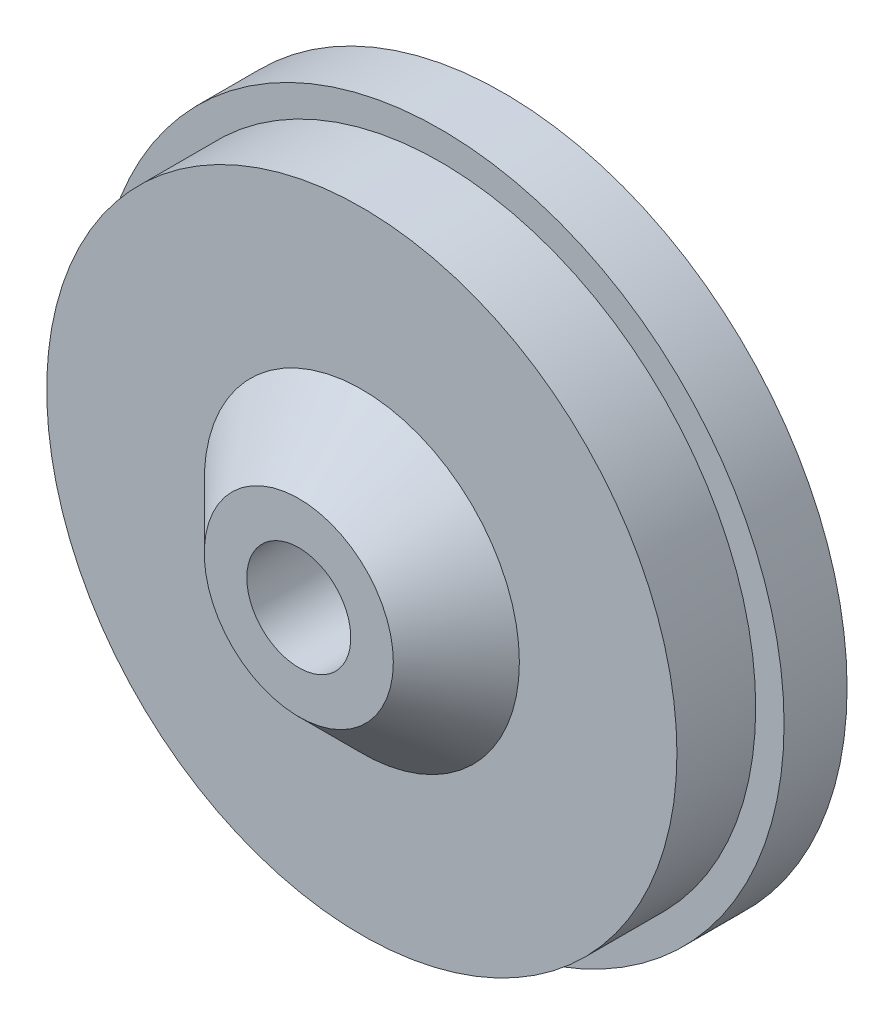
from build123d import *

# Parameters (mm, degrees)
SKETCH1_R           = 10.9
BOSS_EXTRUDE1_DEPTH = 2
SKETCH2_R           = 10
BOSS_EXTRUDE2_DEPTH = 2.5
SKETCH4_R           = 3
BOSS_EXTRUDE3_DEPTH = 2
SKETCH3_R           = 1.65
CUT_EXTRUDE1_DEPTH  = 17.729315587
CHAMFER1_SIZE       = 2


with BuildPart() as part:
    # Sketch1 → Boss-Extrude1 (new body)
    with BuildSketch(Plane.XY):
        Circle(SKETCH1_R)
    extrude(amount=BOSS_EXTRUDE1_DEPTH)

    # Sketch2 → Boss-Extrude2 (add)
    with BuildSketch(Plane.XY.offset(2)):
        Circle(SKETCH2_R)
    extrude(amount=BOSS_EXTRUDE2_DEPTH)

    # Sketch4 → Boss-Extrude3 (add)
    with BuildSketch(Plane.XY.offset(4.5)):
        Circle(SKETCH4_R)
    extrude(amount=BOSS_EXTRUDE3_DEPTH)

    # Sketch3 → Cut-Extrude1 (cut, through all)
    with BuildSketch(Plane(origin=(0, 0, 0), x_dir=(-1, 0, 0), z_dir=(0, 0, -1))):
        Circle(SKETCH3_R)
    extrude(amount=-CUT_EXTRUDE1_DEPTH, mode=Mode.SUBTRACT)

    # Chamfer1
    chamfer1_edges = [part.edges().sort_by_distance(p)[0] for p in [
        (-3, 0, 4.5),
    ]]
    chamfer(chamfer1_edges, length=CHAMFER1_SIZE - 0.0001)  # a hair under: the kernel refuses the full size


solid = part.part
